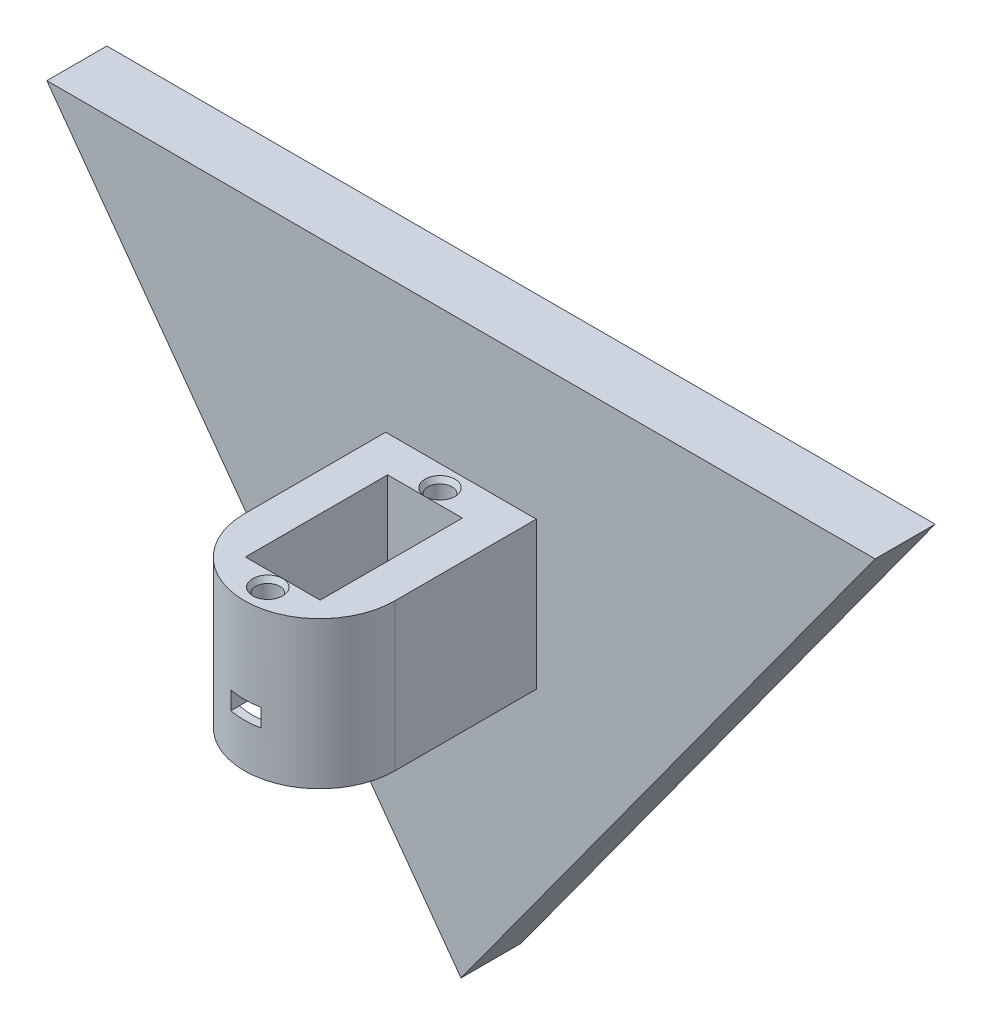
from build123d import *
from OCP.BRepFilletAPI import BRepFilletAPI_MakeChamfer

# Parameters (mm, degrees)
BOSS_EXTRUDE1_DEPTH      = 10
SKETCH4_W                = 12.46
SKETCH4_H                = 17.25
BOSS_EXTRUDE3_DEPTH      = 6
BOSS_EXTRUDE6_DEPTH      = 7.3
BOSS_EXTRUDE6_DEPTH_BACK = 17.25
SKETCH8_R                = 12.546781182
SKETCH8_R_2              = 11.15
BOSS_EXTRUDE4_DEPTH      = 17.25
SKETCH6_R                = 2
CUT_EXTRUDE1_DEPTH       = 5
CHAMFER1_SIZE            = 0.5
CHAMFER1_SIZE_2          = 0.866025404
BOSS_EXTRUDE2_DEPTH      = 10
SKETCH10_W               = 12.46
SKETCH10_H               = 23.7
CUT_EXTRUDE3_DEPTH       = 17.25
CUT_EXTRUDE4_REACH       = 128.15
SKETCH11_W               = 5
SKETCH11_H               = 3
BOSS_EXTRUDE7_START      = -7.3
BOSS_EXTRUDE7_DEPTH      = 7.3


with BuildPart() as part:
    # Sketch1 → Boss-Extrude1 (new body)
    with BuildSketch(Plane.XY):
        Polygon((0, 0), (54.4906896, 75), (-54.4906896, 75), align=None)
    extrude(amount=BOSS_EXTRUDE1_DEPTH)

    # Sketch4 → Boss-Extrude3 (add)
    with BuildSketch(Plane.XY.offset(10)):
        with Locations((0, 63.875025481)):
            Rectangle(SKETCH4_W, SKETCH4_H)
    extrude(amount=BOSS_EXTRUDE3_DEPTH)



with BuildPart() as body_2:
    # Sketch8 → Boss-Extrude6 (new, two sides: drawn at the far end of the back side and taken through both)
    with BuildSketch(Plane(origin=(0, 55.250025481, 0), x_dir=(-1, 0, 0), z_dir=(0, -1, 0)).offset(-BOSS_EXTRUDE6_DEPTH_BACK)):
        with Locations(Location((0, -33.55, 0), (0, 0, 90))):
            Circle(SKETCH8_R)
        with Locations(Location((0, -33.55, 0), (0, 0, 90))):
            Circle(SKETCH8_R_2, mode=Mode.SUBTRACT)
    extrude(amount=BOSS_EXTRUDE6_DEPTH + BOSS_EXTRUDE6_DEPTH_BACK)


with BuildPart() as part_1:
    add(part.part)

    add(body_2.part)  # Boss-Extrude4 merges body 2
    # Sketch5 → Boss-Extrude4 (add)
    with BuildSketch(Plane(origin=(0, 72.500025481, 0), x_dir=(1, 0, 0), z_dir=(0, 1, 0))):
        with BuildLine():
            Line((12.546781182, -33.55), (12.546781182, -10))
            Line((12.546781182, -10), (6.23, -10))
            Line((6.23, -10), (6.23, -39.7))
            Line((6.23, -39.7), (-6.23, -39.7))
            Line((-6.23, -39.7), (-6.23, -10))
            Line((-6.23, -10), (-12.546781182, -10))
            Line((-12.546781182, -10), (-12.546781182, -33.55))
            ThreePointArc((-12.546781182, -33.55), (0, -46.096781182), (12.546781182, -33.55))
        make_face()
    extrude(amount=-BOSS_EXTRUDE4_DEPTH)

    # Sketch6 → Cut-Extrude1 (cut)
    with BuildSketch(Plane(origin=(0, 72.500025481, 0), x_dir=(1, 0, 0), z_dir=(0, 1, 0))):
        with Locations(Location((0, -13.5, 0), (0, 0, 270))):
            Circle(SKETCH6_R)
        with Locations(Location((0, -42.2, 0), (0, 0, 270))):
            Circle(SKETCH6_R)
    extrude(amount=-CUT_EXTRUDE1_DEPTH, mode=Mode.SUBTRACT)

    # Chamfer1
    chamfer1_edges_1 = [part_1.edges().sort_by_distance(p)[0] for p in [
        (0, 72.500025481, 11.5),
    ]]
    chamfer1_side_1 = [part_1.faces().sort_by_distance(p)[0] for p in [
        (0, 72.500025481, 11.49),
    ]]
    chamfer1_edges_2 = [part_1.edges().sort_by_distance(p)[0] for p in [
        (0, 72.500025481, 40.2),
    ]]
    chamfer1_side_2 = [part_1.faces().sort_by_distance(p)[0] for p in [
        (0, 72.500025481, 40.19),
    ]]
    chamfer1 = BRepFilletAPI_MakeChamfer(part_1.part.solid().wrapped)
    for e in chamfer1_edges_1:
        chamfer1.Add(CHAMFER1_SIZE - 0.0001, CHAMFER1_SIZE_2 - 0.0001, e.wrapped, chamfer1_side_1[0].wrapped)
    for e in chamfer1_edges_2:
        chamfer1.Add(CHAMFER1_SIZE - 0.0001, CHAMFER1_SIZE_2 - 0.0001, e.wrapped, chamfer1_side_2[0].wrapped)
    add(Compound.cast(chamfer1.Shape()), mode=Mode.REPLACE)  # a hair under: the kernel refuses the full size

    # Sketch2 → Boss-Extrude2 (add)
    with BuildSketch(Plane.XY):
        Polygon((-54.4906896, 75), (-69.021540161, 95), (69.021540161, 95), (54.4906896, 75), align=None)
    extrude(amount=BOSS_EXTRUDE2_DEPTH)

    # Sketch10 → Cut-Extrude3 (cut)
    with BuildSketch(Plane(origin=(0, 72.500025481, 0), x_dir=(1, 0, 0), z_dir=(0, 1, 0))):
        with Locations((0, -27.85)):
            Rectangle(SKETCH10_W, SKETCH10_H)
    extrude(amount=-CUT_EXTRUDE3_DEPTH, mode=Mode.SUBTRACT)

    # Sketch11 → Cut-Extrude4 (cut, up to next)
    with BuildSketch(Plane.XY.offset(46.096781182), mode=Mode.PRIVATE) as cut_extrude4_sk1:
        with Locations((0, 56.750025481)):
            Rectangle(SKETCH11_W, SKETCH11_H)
    cut_extrude4_tool1 = extrude(cut_extrude4_sk1.sketch, amount=-CUT_EXTRUDE4_REACH, mode=Mode.PRIVATE) & part_1.part
    add(cut_extrude4_tool1.solids().sort_by_distance((0, 56.750025, 46.096781))[0], mode=Mode.SUBTRACT)

    # Sketch13 → Boss-Extrude7 (add)
    with BuildSketch(Plane.XZ.offset(-47.950025481).offset(BOSS_EXTRUDE7_START)):
        with BuildLine():
            Line((-12.546781182, 33.55), (-12.546781182, 10))
            Line((-12.546781182, 10), (12.546781182, 10))
            Line((12.546781182, 10), (12.546781182, 33.55))
            ThreePointArc((12.546781182, 33.55), (0, 21.003218818), (-12.546781182, 33.55))
        make_face()
    extrude(amount=BOSS_EXTRUDE7_DEPTH)


solid = part_1.part
